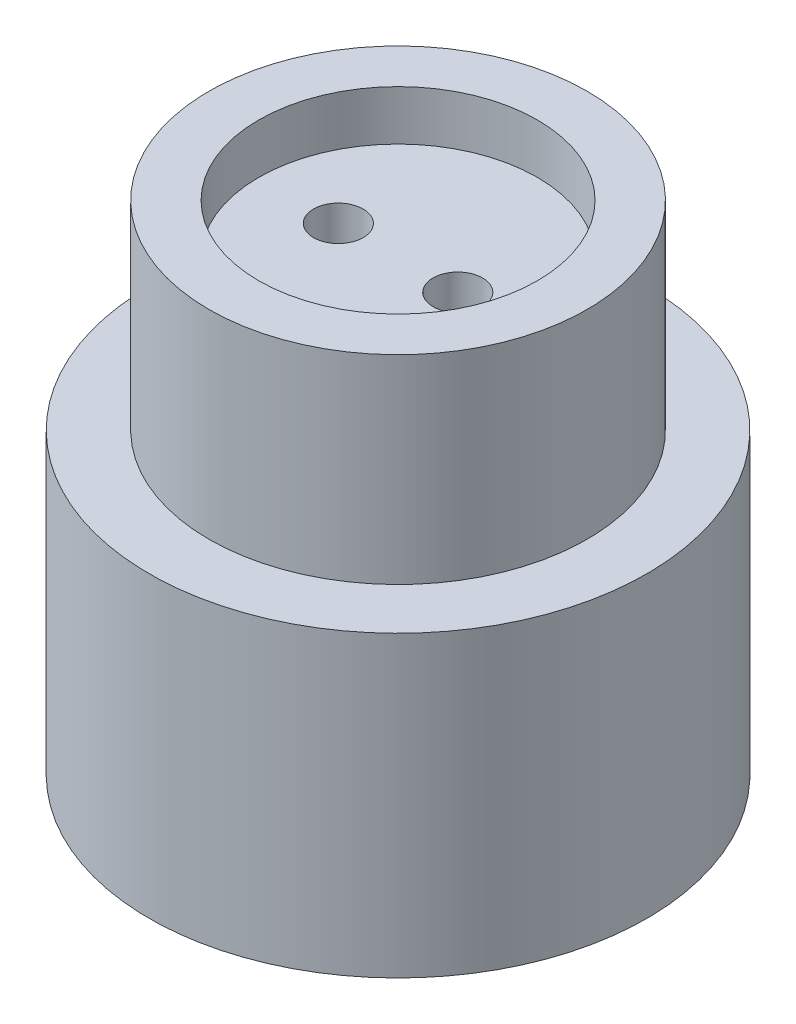
from build123d import *

# Parameters (mm, degrees)
BOSS_EXTRUDE1_START = -0.3
SKETCH3_R           = 1.4
BOSS_EXTRUDE1_DEPTH = 0.3
SKETCH4_R           = 0.349337209
SKETCH4_R_2         = 0.249337209
CUT_EXTRUDE6_START  = -0.7
SKETCH8_R           = 0.249337209
CUT_EXTRUDE6_DEPTH  = 0.7
CUT_EXTRUDE7_START  = -0.3
SKETCH4_5_R         = 0.249337209
CUT_EXTRUDE7_DEPTH  = 0.3


with BuildPart() as part:
    # Sketch2 → Revolve1 (revolve)
    with BuildSketch(Plane(origin=(0, 0, 0), x_dir=(0, 0, -1), z_dir=(1, 0, 0))):
        Polygon((0, 0), (2.5, 0), (2.5, 3), (1.9, 3), (1.9, 5), (1.4, 5), (1.4, 2.5), (2, 2.5), (2, 0.5), (0, 0.5), align=None)
    revolve(axis=Axis((0, 0, 0), (0, 1, 0)))

    # Sketch3 → Boss-Extrude1 (add)
    with BuildSketch(Plane(origin=(0, 4.5, 0), x_dir=(1, 0, 0), z_dir=(0, 1, 0)).offset(BOSS_EXTRUDE1_START)):
        Circle(SKETCH3_R)
    extrude(amount=BOSS_EXTRUDE1_DEPTH)

    # Sweep2: sweep along a path in Sketch5
    with BuildLine(Plane.XY) as sweep2_path:
        Line((0.6, 4.5), (0.6, 2))
        Line((0.6, 2), (1.3, 2))
        Line((1.3, 2), (1.3, 0.5))
    # Sketch4 → Sweep2 (sweep)
    with BuildSketch(Plane(origin=(0, 4.5, 0), x_dir=(1, 0, 0), z_dir=(0, 1, 0))):
        with Locations((0.6, 0)):
            Circle(SKETCH4_R)
        with Locations((0.6, 0)):
            Circle(SKETCH4_R_2, mode=Mode.SUBTRACT)
    sweep2 = sweep(path=sweep2_path.line, transition=Transition.RIGHT)

    # Sketch8 → Cut-Extrude6 (cut)
    with BuildSketch(Plane(origin=(0, 0.5, 0), x_dir=(1, 0, 0), z_dir=(0, 1, 0)).offset(CUT_EXTRUDE6_START)):
        with Locations((1.3, 0)):
            Circle(SKETCH8_R)
    cut_extrude6 = extrude(amount=CUT_EXTRUDE6_DEPTH, mode=Mode.SUBTRACT)

    # Sketch4<5> → Cut-Extrude7 (cut)
    with BuildSketch(Plane(origin=(0, 4.5, 0), x_dir=(1, 0, 0), z_dir=(0, 1, 0)).offset(CUT_EXTRUDE7_START)):
        with Locations((0.6, 0)):
            Circle(SKETCH4_5_R)
    cut_extrude7 = extrude(amount=CUT_EXTRUDE7_DEPTH, mode=Mode.SUBTRACT)

    # Mirror1: Sweep2, Cut-Extrude6, Cut-Extrude7 across plane
    add(sweep2.mirror(Plane(origin=(0, 0, 0), x_dir=(0, 0, 1), z_dir=(1, 0, 0))))
    add(cut_extrude6.mirror(Plane(origin=(0, 0, 0), x_dir=(0, 0, 1), z_dir=(1, 0, 0))), mode=Mode.SUBTRACT)
    add(cut_extrude7.mirror(Plane(origin=(0, 0, 0), x_dir=(0, 0, 1), z_dir=(1, 0, 0))), mode=Mode.SUBTRACT)


solid = part.part
